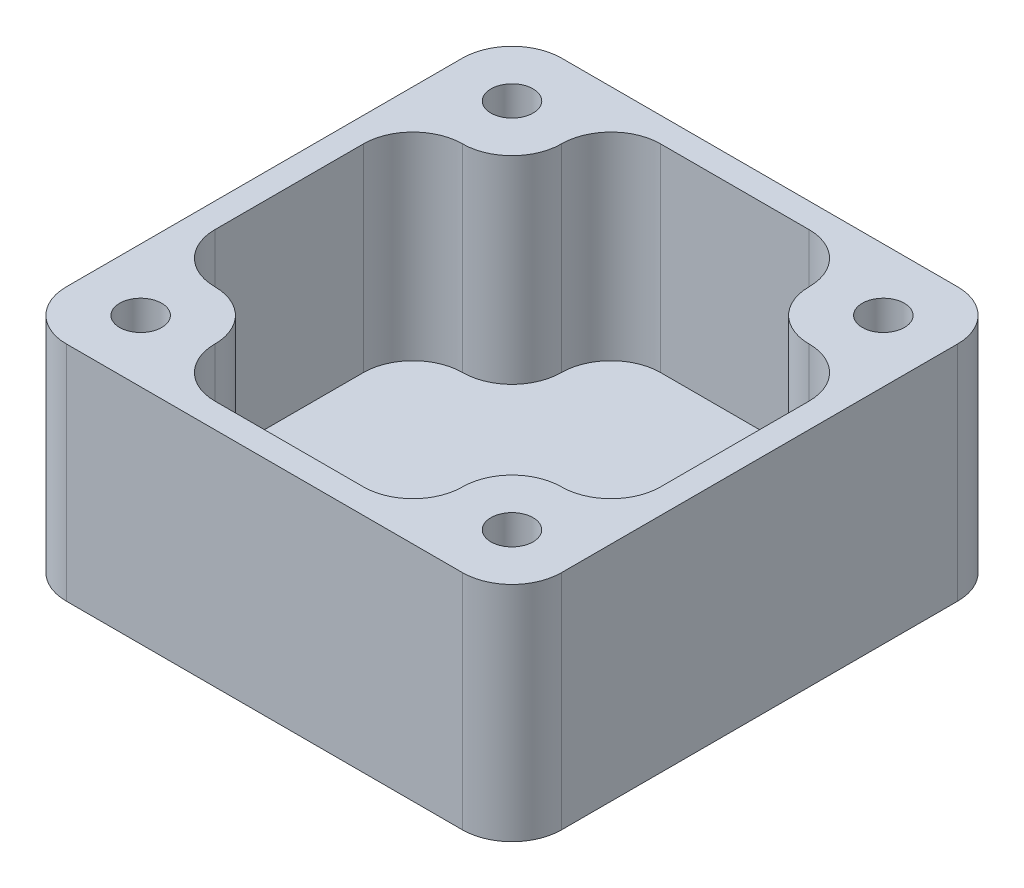
from build123d import *

# Parameters (mm, degrees)
SKETCH1_W           = 40
SKETCH1_H           = 40
BOSS_EXTRUDE1_DEPTH = 18
SKETCH2_R           = 1.7
CUT_EXTRUDE1_DEPTH  = 34.526109228
SKETCH3_W           = 36
SKETCH3_H           = 20
CUT_EXTRUDE2_DEPTH  = 16
CIRPATTERN1_COUNT   = 2
CIRPATTERN1_ANGLE   = 90
FILLET1_R           = 4


with BuildPart() as part:
    # Sketch1 → Boss-Extrude1 (new body)
    with BuildSketch(Plane(origin=(0, 0, 0), x_dir=(1, 0, 0), z_dir=(0, 1, 0))):
        Rectangle(SKETCH1_W, SKETCH1_H)
    extrude(amount=BOSS_EXTRUDE1_DEPTH)

    # Sketch2 → Cut-Extrude1 (cut, through all)
    with BuildSketch(Plane(origin=(0, 18, 0), x_dir=(1, 0, 0), z_dir=(0, 1, 0))):
        with Locations(Location((15, 15, 0), (0, 0, 270))):
            Circle(SKETCH2_R)
        with Locations(Location((15, -15, 0), (0, 0, 270))):
            Circle(SKETCH2_R)
        with Locations(Location((-15, -15, 0), (0, 0, 270))):
            Circle(SKETCH2_R)
        with Locations(Location((-15, 15, 0), (0, 0, 270))):
            Circle(SKETCH2_R)
    extrude(amount=-CUT_EXTRUDE1_DEPTH, mode=Mode.SUBTRACT)

    # Sketch3 → Cut-Extrude2 (cut)
    with BuildSketch(Plane(origin=(0, 18, 0), x_dir=(1, 0, 0), z_dir=(0, 1, 0))):
        Rectangle(SKETCH3_W, SKETCH3_H)
    cut_extrude2 = extrude(amount=-CUT_EXTRUDE2_DEPTH, mode=Mode.SUBTRACT)

    # CirPattern1: Cut-Extrude2 ×2 about axis
    cirpattern1_axis = Axis((0, 0, 0), (0, -1, 0))
    for i in range(1, CIRPATTERN1_COUNT):
        add(cut_extrude2.rotate(cirpattern1_axis, i * CIRPATTERN1_ANGLE / (CIRPATTERN1_COUNT - 1)), mode=Mode.SUBTRACT)

    # Fillet1
    fillet1_edges = [part.edges().sort_by_distance(p)[0] for p in [
        (20, 9, -20),
        (-20, 9, -20),
        (-20, 9, 20),
        (20, 9, 20),
        (-10, 10, 18),
        (-10, 10, 10),
        (-18, 10, 10),
        (-18, 10, -10),
        (-10, 10, -10),
        (-10, 10, -18),
        (10, 10, -18),
        (10, 10, -10),
        (18, 10, -10),
        (18, 10, 10),
        (10, 10, 18),
        (10, 10, 10),
    ]]
    fillet(fillet1_edges, radius=FILLET1_R - 0.0001)  # a hair under: the kernel refuses the full size


solid = part.part
